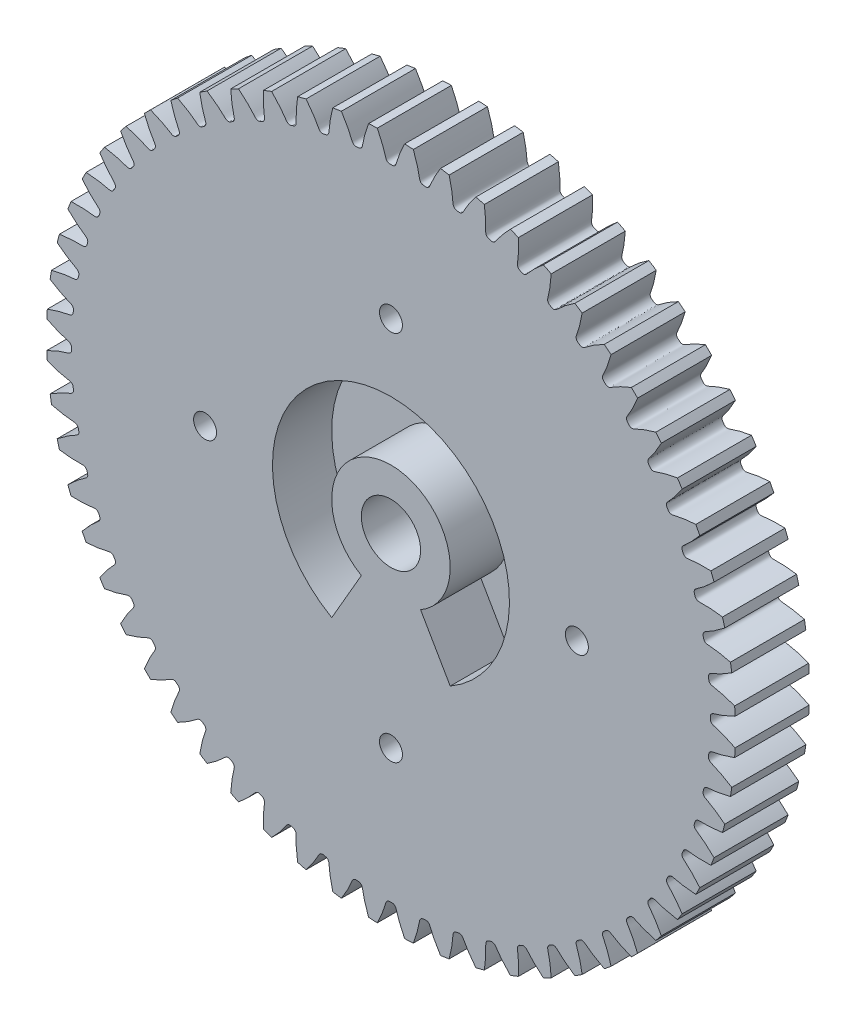
from build123d import *

# Parameters (mm, degrees)
SKETCHREVOLVESPURASSEMBLY01GEAR_W       = 10
SKETCHREVOLVESPURASSEMBLY01GEAR_H       = 46.499999302
TOOTHEXTRUDECUTSPURASSEMBLY01GEAR_DEPTH = 5
PATTERNSPURASSEMBLY01GEAR_COUNT         = 60
SKETCH5_R                               = 4
CUT_EXTRUDE2_DEPTH                      = 18
SKETCH6_R                               = 1.55
CUT_EXTRUDE3_DEPTH                      = 10
CIRPATTERN2_COUNT                       = 4
CUT_EXTRUDE4_DEPTH                      = 8


with BuildPart() as part:
    # SketchRevolveSpurAssembly01Gear → SpurAssembly01Gear (revolve)
    with BuildSketch(Plane(origin=(0, 0, 0), x_dir=(0, 0, -1), z_dir=(1, 0, 0))):
        with Locations((0, 23.249999651)):
            Rectangle(SKETCHREVOLVESPURASSEMBLY01GEAR_W, SKETCHREVOLVESPURASSEMBLY01GEAR_H)
    revolve(axis=Axis((0, 0, 0), (0, 0, -1)))

    # SketchToothSpurAssembly01Gear → ToothExtrudeCutSpurAssembly01Gear (cut, symmetric)
    with BuildSketch(Plane.XY):
        with BuildLine():
            ThreePointArc((46.536941888, 1.882445097), (46.574999301, 0), (46.536941888, -1.882445097))
            add(Edge.make_bspline(
                [(46.536941888, -1.882445097), (46.410580772, -1.817790323), (46.222345848, -1.724049646), (45.97247157, -1.604862074), (45.79126821, -1.520902479), (45.613955508, -1.441140119), (45.440604048, -1.365477285), (45.271282713, -1.293815196), (45.106058665, -1.226054069), (44.944997361, -1.162093066), (44.788162422, -1.101830604), (44.635616032, -1.045163354), (44.487417476, -0.991989937), (44.343628263, -0.942197901), (44.204293895, -0.895710038), (44.06950835, -0.852320586), (43.939186277, -0.812273822), (43.755364294, -0.756463501), (43.591162201, -0.718537687), (43.456933301, -0.660411719), (43.396978032, -0.628409971), (43.333262239, -0.585604909), (43.264730377, -0.524892475), (43.194956481, -0.436129591), (43.140009905, -0.315401482), (43.119097636, -0.163510161), (43.128214427, 0), (43.119097636, 0.163510161), (43.140009905, 0.315401482), (43.194956481, 0.436129591), (43.264730377, 0.524892475), (43.333262239, 0.585604909), (43.396978032, 0.628409971), (43.456933301, 0.660411719), (43.591162201, 0.718537687), (43.755364294, 0.756463501), (43.939186277, 0.812273822), (44.06950835, 0.852320586), (44.204293895, 0.895710038), (44.343628263, 0.942197901), (44.487417476, 0.991989937), (44.635616032, 1.045163354), (44.788162422, 1.101830604), (44.944997361, 1.162093066), (45.106058665, 1.226054069), (45.271282713, 1.293815196), (45.440604048, 1.365477285), (45.613955508, 1.441140119), (45.79126821, 1.520902479), (45.97247157, 1.604862074), (46.222345848, 1.724049646), (46.410580772, 1.817790323), (46.536941888, 1.882445097)],
                knots=[0, 0, 0, 0, 0.05176586, 0.076685537, 0.100963046, 0.124598386, 0.147591557, 0.16994256, 0.191651394, 0.21271806, 0.233142557, 0.252924885, 0.272065045, 0.290563036, 0.308418859, 0.325632513, 0.342203998, 0.358133315, 0.395728589, 0.403326908, 0.411414611, 0.420483419, 0.431260975, 0.444674611, 0.46138654, 0.478964563, 0.5, 0.521035437, 0.53861346, 0.555325389, 0.568739025, 0.579516581, 0.588585389, 0.596673092, 0.604271411, 0.641866685, 0.657796002, 0.674367487, 0.691581141, 0.709436964, 0.727934955, 0.747075115, 0.766857443, 0.78728194, 0.808348606, 0.83005744, 0.852408443, 0.875401614, 0.899036954, 0.923314463, 0.94823414, 1, 1, 1, 1], degree=3))
        make_face()
    toothextrudecutspurassembly01gear = extrude(amount=TOOTHEXTRUDECUTSPURASSEMBLY01GEAR_DEPTH, both=True, mode=Mode.SUBTRACT)

    # PatternSpurAssembly01Gear: ToothExtrudeCutSpurAssembly01Gear ×60 about axis
    patternspurassembly01gear_axis = Axis((0, 0, 5.5), (0, 0, -1))
    for i in range(1, PATTERNSPURASSEMBLY01GEAR_COUNT):
        add(toothextrudecutspurassembly01gear.rotate(patternspurassembly01gear_axis, i * 360 / PATTERNSPURASSEMBLY01GEAR_COUNT), mode=Mode.SUBTRACT)

    # Sketch5 → Cut-Extrude2 (cut)
    with BuildSketch(Plane(origin=(0, 0, -5), x_dir=(-1, 0, 0), z_dir=(0, 0, -1))):
        Circle(SKETCH5_R)
    extrude(amount=-CUT_EXTRUDE2_DEPTH, mode=Mode.SUBTRACT)

    # Sketch6 → Cut-Extrude3 (cut)
    with BuildSketch(Plane(origin=(0, 0, -5), x_dir=(-1, 0, 0), z_dir=(0, 0, -1))):
        with Locations((25.1, 0)):
            Circle(SKETCH6_R)
    cut_extrude3 = extrude(amount=-CUT_EXTRUDE3_DEPTH, mode=Mode.SUBTRACT)

    # CirPattern2: Cut-Extrude3 ×4 about axis
    cirpattern2_axis = Axis((0, 0, 5.5), (0, 0, -1))
    for i in range(1, CIRPATTERN2_COUNT):
        add(cut_extrude3.rotate(cirpattern2_axis, i * 360 / CIRPATTERN2_COUNT), mode=Mode.SUBTRACT)

    # Sketch4 → Cut-Extrude4 (cut)
    with BuildSketch(Plane.XY.offset(5)):
        with BuildLine():
            Line((-4, -6.92820323), (-8, -13.856406461))
            ThreePointArc((-8, -13.856406461), (0, 16), (8, -13.856406461))
            Line((8, -13.856406461), (4, -6.92820323))
            ThreePointArc((4, -6.92820323), (0, 8), (-4, -6.92820323))
        make_face()
    extrude(amount=-CUT_EXTRUDE4_DEPTH, mode=Mode.SUBTRACT)


solid = part.part
